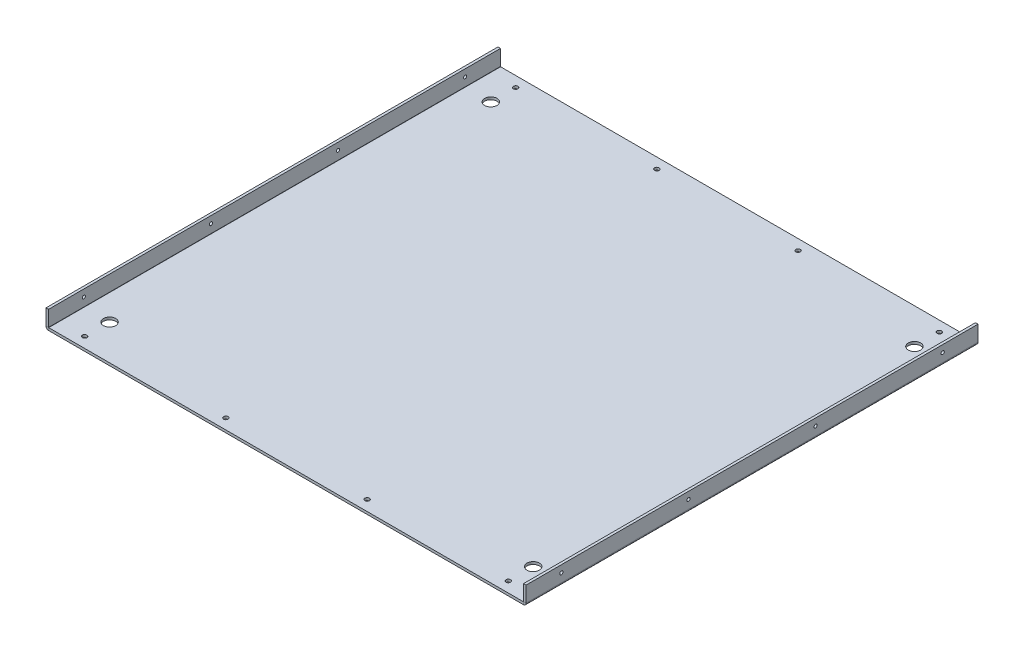
from build123d import *

# Parameters (mm, degrees)
BASE_FLANGE3_DEPTH             = 406.4
SKETCH10_R                     = 1.4478
CUT_EXTRUDE3_DEPTH             = 594.198769469
SKETCH11_R                     = 2.032
CUT_EXTRUDE4_DEPTH             = 594.139546967
F_7_16_0_4375_DIAMETER_HOLE1_D = 11.1125


# Sheet-metal steps are written as plain solids
with BuildPart() as part:
    # Sketch1 → Base-Flange3 (new body)
    with BuildSketch(Plane.XY):
        with BuildLine():
            Line((431.8, 16.51), (431.8, 2.4384))
            ThreePointArc((431.8, 2.4384), (431.085809175, 0.714190825), (429.3616, 0))
            Line((429.3616, 0), (2.4384, 0))
            ThreePointArc((2.4384, 0), (0.714190825, 0.714190825), (0, 2.4384))
            Line((0, 2.4384), (0, 16.51))
            Line((0, 16.51), (2.286, 16.51))
            Line((2.286, 16.51), (2.286, 2.4384))
            ThreePointArc((2.286, 2.4384), (2.330636927, 2.330636927), (2.4384, 2.286))
            Line((2.4384, 2.286), (429.3616, 2.286))
            ThreePointArc((429.3616, 2.286), (429.469363073, 2.330636927), (429.514, 2.4384))
            Line((429.514, 2.4384), (429.514, 16.51))
            Line((429.514, 16.51), (431.8, 16.51))
        make_face()
    extrude(amount=BASE_FLANGE3_DEPTH)

    # Sketch10 → Cut-Extrude3 (cut, through all)
    with BuildSketch(Plane(origin=(431.8, 0, 0), x_dir=(0, 0, -1), z_dir=(1, 0, 0))):
        with Locations((-31.75, 10.16)):
            Circle(SKETCH10_R)
        with Locations((-146.05, 10.16)):
            Circle(SKETCH10_R)
        with Locations((-260.35, 10.16)):
            Circle(SKETCH10_R)
        with Locations((-374.65, 10.16)):
            Circle(SKETCH10_R)
    extrude(amount=-CUT_EXTRUDE3_DEPTH, mode=Mode.SUBTRACT)

    # Sketch11 → Cut-Extrude4 (cut, through all)
    with BuildSketch(Plane(origin=(0, 2.286, 0), x_dir=(-1, 0, 0), z_dir=(0, 1, 0))):
        with Locations(Location((-406.4, 397.002, 0), (0, 0, 90))):
            Circle(SKETCH11_R)
        with Locations(Location((-279.4, 397.002, 0), (0, 0, 90))):
            Circle(SKETCH11_R)
        with Locations(Location((-152.4, 397.002, 0), (0, 0, 90))):
            Circle(SKETCH11_R)
        with Locations(Location((-25.4, 397.002, 0), (0, 0, 90))):
            Circle(SKETCH11_R)
        with Locations(Location((-406.4, 9.398, 0), (0, 0, 90))):
            Circle(SKETCH11_R)
        with Locations(Location((-279.4, 9.398, 0), (0, 0, 90))):
            Circle(SKETCH11_R)
        with Locations(Location((-152.4, 9.398, 0), (0, 0, 90))):
            Circle(SKETCH11_R)
        with Locations(Location((-25.4, 9.398, 0), (0, 0, 90))):
            Circle(SKETCH11_R)
    extrude(amount=-CUT_EXTRUDE4_DEPTH, mode=Mode.SUBTRACT)

    # 7/16 (0.4375) Diameter Hole1 (through all)
    with Locations(Plane(origin=(0, 2.286, 0), x_dir=(1, 0, 0), z_dir=(0, 1, 0))):
        with Locations((25.4, -31.75), (406.4, -31.75), (406.4, -374.65), (25.4, -374.65)):
            Hole(F_7_16_0_4375_DIAMETER_HOLE1_D / 2)


solid = part.part
